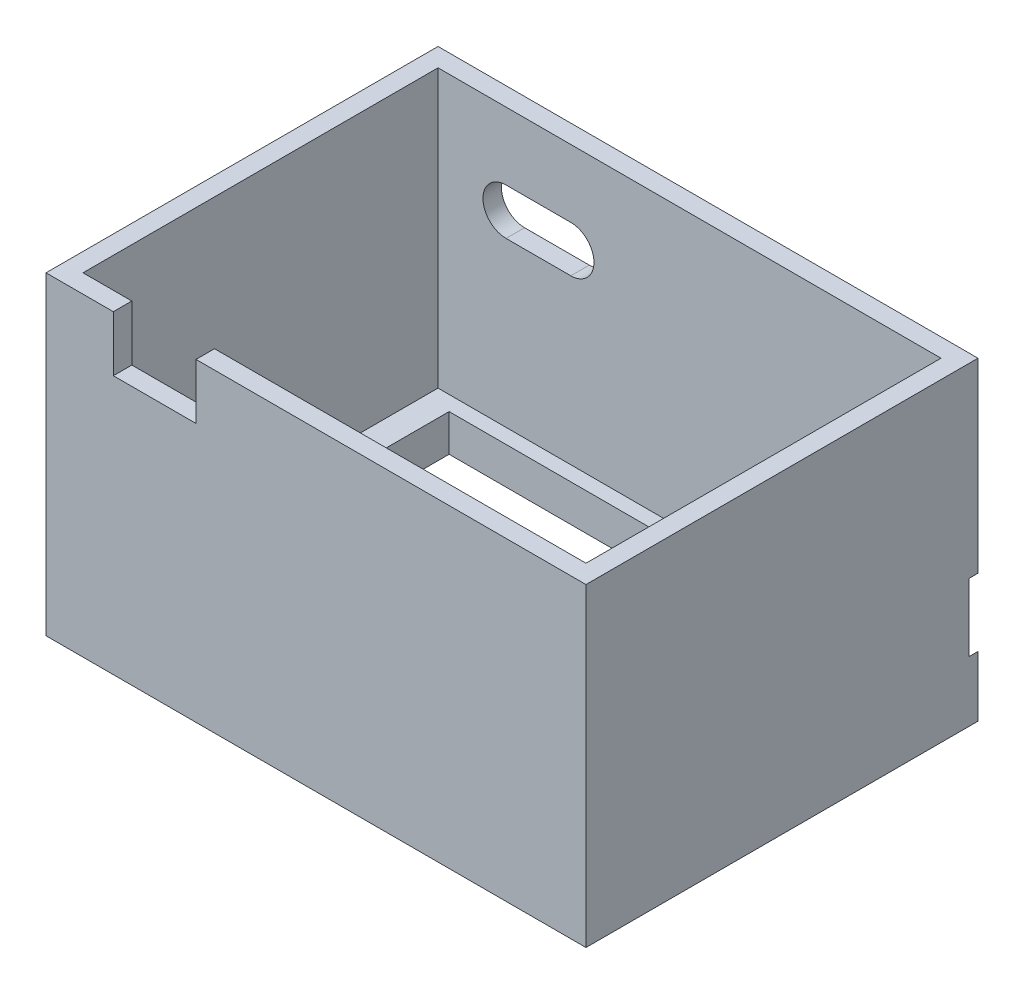
from build123d import *

# Parameters (mm, degrees)
SKETCH_1_W          = 29.2
SKETCH_1_H          = 21.2
EXTRUDE_1_DEPTH     = 17
SKETCH_2_W          = 27.2
SKETCH_2_H          = 19.2
CUT_EXTRUDE_1_DEPTH = 15
SKETCH_4_W          = 17.6
SKETCH_4_H          = 17.6
CUT_EXTRUDE_2_DEPTH = 15
CUT_EXTRUDE_3_DEPTH = 15
SKETCH_6_W          = 4.469096809
SKETCH_6_H          = 3
CUT_EXTRUDE_4_DEPTH = 5
CUT_EXTRUDE_7_DEPTH = 0.5
CUT_EXTRUDE_8_DEPTH = 0.5


with BuildPart() as part:
    # 草图1 → 凸台-拉伸1 (new body)
    with BuildSketch(Plane(origin=(0, 0, 0), x_dir=(1, 0, 0), z_dir=(0, 1, 0))):
        with Locations((-54.575859317, -18.879739962)):
            Rectangle(SKETCH_1_W, SKETCH_1_H)
    extrude(amount=EXTRUDE_1_DEPTH)

    # 草图2 → 切除-拉伸1 (cut)
    with BuildSketch(Plane(origin=(0, 17, 0), x_dir=(1, 0, 0), z_dir=(0, 1, 0))):
        with Locations((-54.575859317, -18.879739962)):
            Rectangle(SKETCH_2_W, SKETCH_2_H)
    extrude(amount=-CUT_EXTRUDE_1_DEPTH, mode=Mode.SUBTRACT)

    # 草图4 → 切除-拉伸2 (cut)
    with BuildSketch(Plane(origin=(0, 0, 0), x_dir=(-1, 0, 0), z_dir=(0, -1, 0))):
        with Locations((57.975859317, -18.879739962)):
            Rectangle(SKETCH_4_W, SKETCH_4_H)
    extrude(amount=-CUT_EXTRUDE_2_DEPTH, mode=Mode.SUBTRACT)

    # 草图5 → 切除-拉伸3 (cut)
    with BuildSketch(Plane(origin=(0, 0, 8.279739962), x_dir=(-1, 0, 0), z_dir=(0, 0, -1))):
        with BuildLine():
            Line((64.495859317, 10.85), (60.995859317, 10.85))
            ThreePointArc((60.995859317, 10.85), (59.745859317, 12.1), (60.995859317, 13.35))
            Line((60.995859317, 13.35), (64.495859317, 13.35))
            ThreePointArc((64.495859317, 13.35), (65.745859317, 12.1), (64.495859317, 10.85))
        make_face()
    extrude(amount=-CUT_EXTRUDE_3_DEPTH, mode=Mode.SUBTRACT)

    # 草图6 → 切除-拉伸4 (cut)
    with BuildSketch(Plane.XY.offset(29.479739962)):
        with Locations((-63.299412027, 15.5)):
            Rectangle(SKETCH_6_W, SKETCH_6_H)
    extrude(amount=-CUT_EXTRUDE_4_DEPTH, mode=Mode.SUBTRACT)

    # 草图7 → 切除-拉伸7 (cut)
    with BuildSketch(Plane(origin=(0, 0, 8.279739962), x_dir=(-1, 0, 0), z_dir=(0, 0, -1))):
        with BuildLine():
            Line((49.275859317, 1.5), (43.075859317, 1.5))
            ThreePointArc((43.075859317, 1.5), (39.475859317, 5.1), (43.075859317, 8.7))
            Line((43.075859317, 8.7), (49.275859317, 8.7))
            ThreePointArc((49.275859317, 8.7), (52.875859317, 5.1), (49.275859317, 1.5))
        make_face()
    extrude(amount=-CUT_EXTRUDE_7_DEPTH, mode=Mode.SUBTRACT)

    # 草图9 → 切除-拉伸8 (cut)
    with BuildSketch(Plane(origin=(0, 0, 8.779739962), x_dir=(-1, 0, 0), z_dir=(0, 0, -1))):
        with BuildLine():
            Line((49.275859317, 3.5), (43.475859317, 3.5))
            ThreePointArc((43.475859317, 3.5), (41.875859317, 5.1), (43.475859317, 6.7))
            Line((43.475859317, 6.7), (49.275859317, 6.7))
            ThreePointArc((49.275859317, 6.7), (50.875859317, 5.1), (49.275859317, 3.5))
        make_face()
    extrude(amount=-CUT_EXTRUDE_8_DEPTH, mode=Mode.SUBTRACT)


solid = part.part
